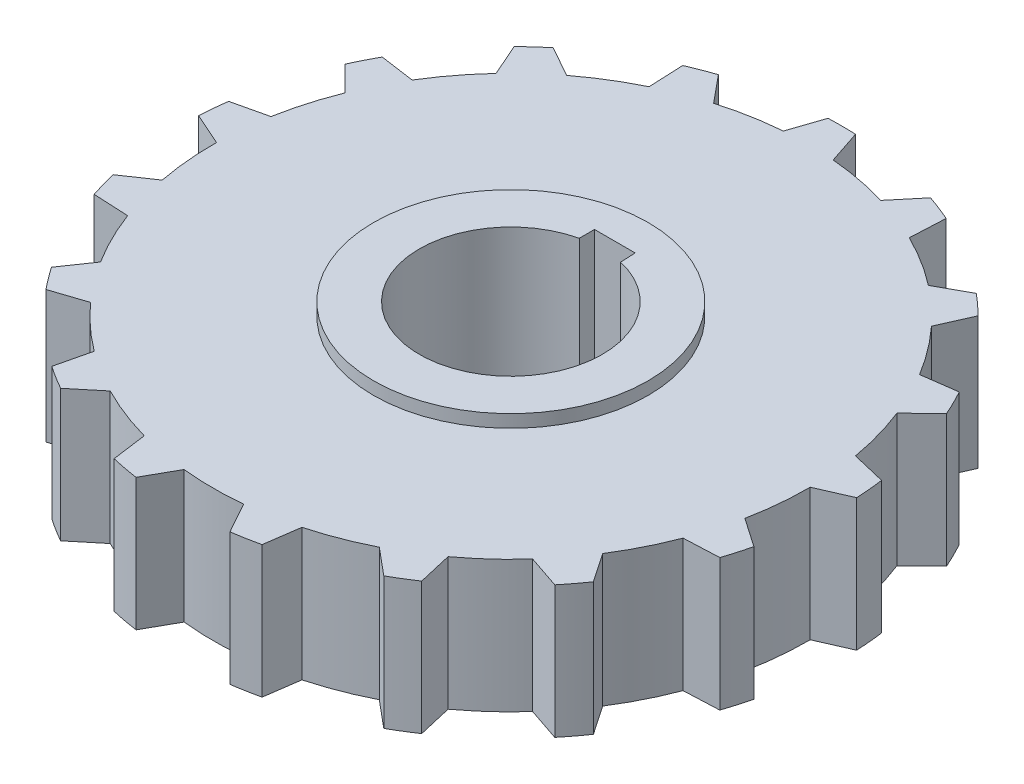
from build123d import *

# Parameters (mm, degrees)
SKETCH3_R           = 165
BOSS_EXTRUDE1_DEPTH = 32.5
SKETCH5_R           = 67.5
BOSS_EXTRUDE2_DEPTH = 38.75
CUT_EXTRUDE1_DEPTH  = 77.5
CUT_EXTRUDE2_START  = -65
CUT_EXTRUDE2_DEPTH  = 65
CUT_EXTRUDE4_DEPTH  = 244.931170023
SKETCH10_R          = 165
SKETCH10_R_2        = 162.5
CUT_EXTRUDE5_DEPTH  = 244.819721335


# Read off the part's stored shape, not the designer's step: Cut-Extrude2
with BuildPart() as part:
    # Sketch3 → Boss-Extrude1 (new, symmetric)
    with BuildSketch(Plane(origin=(0, 0, 0), x_dir=(1, 0, 0), z_dir=(0, 1, 0))):
        with Locations(Location((0, 0, 0), (0, 0, 270))):
            Circle(SKETCH3_R)
    extrude(amount=BOSS_EXTRUDE1_DEPTH, both=True)

    # Sketch5 → Boss-Extrude2 (add, symmetric)
    with BuildSketch(Plane(origin=(0, 0, 0), x_dir=(1, 0, 0), z_dir=(0, 1, 0))):
        with Locations(Location((0, 0, 0), (0, 0, 270))):
            Circle(SKETCH5_R)
    extrude(amount=BOSS_EXTRUDE2_DEPTH, both=True)

    # Sketch6 → Cut-Extrude1 (cut)
    with BuildSketch(Plane(origin=(0, 38.75, 0), x_dir=(1, 0, 0), z_dir=(0, 1, 0))):
        with BuildLine():
            Line((-10.176530617, 43.834212946), (-10.176530617, 51.334212946))
            Line((-10.176530617, 51.334212946), (9.823467655, 51.325898107))
            Line((9.823467655, 51.325898107), (10.176530617, 43.834212946))
            ThreePointArc((10.176530617, 43.834212946), (0, -45), (-10.176530617, 43.834212946))
        make_face()
    extrude(amount=-CUT_EXTRUDE1_DEPTH, mode=Mode.SUBTRACT)

    # Cut-Extrude2 outline → Cut-Extrude2 (cut)
    with BuildSketch(Plane(origin=(0, 32.5, 0), x_dir=(1, 0, 0), z_dir=(0, 1, 0)).offset(CUT_EXTRUDE2_START)):
        with BuildLine():
            ThreePointArc((-144.901893855, -21.164686614), (-145.807749666, -13.586866441), (-146.317587116, -5.972143919))
            Line((-146.317587116, -5.972143919), (-164.906164085, 5.563905713))
            ThreePointArc((-164.906164085, 5.563905713), (-164.325820919, -14.900489227), (-161.215685462, -35.135491472))
            Line((-161.215685462, -35.135491472), (-144.901893855, -21.164686614))
        make_face()
        with BuildLine():
            ThreePointArc((-151.760503896, 64.759165043), (-158.611942136, 45.467040938), (-163.021553119, 25.474952768))
            Line((-163.021553119, 25.474952768), (-142.762558665, 32.609119058))
            ThreePointArc((-142.762558665, 32.609119058), (-140.869819667, 40.002458791), (-138.594473879, 47.287150608))
            Line((-138.594473879, 47.287150608), (-151.760503896, 64.759165043))
        make_face()
        with BuildLine():
            Line((-134.279699439, -58.424867317), (-155.780333037, -54.382789914))
            ThreePointArc((-155.780333037, -54.382789914), (-147.846587026, -73.255625755), (-137.636746156, -91.000692896))
            Line((-137.636746156, -91.000692896), (-127.471425351, -72.080084082))
            ThreePointArc((-127.471425351, -72.080084082), (-131.053535124, -65.341210074), (-134.279699439, -58.424867317))
        make_face()
        with BuildLine():
            ThreePointArc((-118.118746723, 115.208340291), (-131.476641669, 99.693995283), (-142.810456694, 82.644863475))
            Line((-142.810456694, 82.644863475), (-121.342348853, 81.978882508))
            ThreePointArc((-121.342348853, 81.978882508), (-116.906639936, 88.189230302), (-112.153408966, 94.160053418))
            Line((-112.153408966, 94.160053418), (-118.118746723, 115.208340291))
        make_face()
        with BuildLine():
            Line((-104.106594283, -102.98698864), (-125.615504804, -106.984788418))
            ThreePointArc((-125.615504804, -106.984788418), (-111.399852309, -121.717184101), (-95.46920161, -134.575746492))
            Line((-95.46920161, -134.575746492), (-92.82523451, -113.260666785))
            ThreePointArc((-92.82523451, -113.260666785), (-98.59981447, -108.270861218), (-104.106594283, -102.98698864))
        make_face()
        with BuildLine():
            ThreePointArc((-68.524398286, 150.097990791), (-86.584692207, 140.45672314), (-103.312016753, 128.653127418))
            Line((-103.312016753, 128.653127418), (-83.534182446, 120.276943615))
            ThreePointArc((-83.534182446, 120.276943615), (-77.154570678, 124.465557588), (-70.565404709, 128.316119255))
            Line((-70.565404709, 128.316119255), (-68.524398286, 150.097990791))
        make_face()
        with BuildLine():
            Line((-59.873316695, -133.640146477), (-78.485606588, -145.137898423))
            ThreePointArc((-78.485606588, -145.137898423), (-59.90795025, -153.740162277), (-40.408012374, -159.975599814))
            Line((-40.408012374, -159.975599814), (-45.642481386, -139.144768839))
            ThreePointArc((-45.642481386, -139.144768839), (-52.829642513, -136.577932604), (-59.873316695, -133.640146477))
        make_face()
        with BuildLine():
            ThreePointArc((-9.675450153, 164.716075913), (-29.99900028, 162.249992241), (-49.860716477, 157.286073612))
            Line((-49.860716477, 157.286073612), (-34.444261822, 142.330937009))
            ThreePointArc((-34.444261822, 142.330937009), (-26.982349124, 143.932121634), (-19.44715153, 145.142382162))
            Line((-19.44715153, 145.142382162), (-9.675450153, 164.716075913))
        make_face()
        with BuildLine():
            Line((-7.553815918, -146.244462006), (-20.755792298, -163.689331009))
            ThreePointArc((-20.755792298, -163.689331009), (-0.325147548, -164.999679633), (20.110502842, -163.769861927))
            Line((20.110502842, -163.769861927), (7.704541763, -146.236598834))
            ThreePointArc((7.704541763, -146.236598834), (0.075465406, -146.439397388), (-7.553815918, -146.244462006))
        make_face()
        with BuildLine():
            ThreePointArc((50.480221136, 157.08834226), (30.638222865, 162.130500831), (10.324549847, 164.676664013))
            Line((10.324549847, 164.676664013), (19.297547224, 145.162348677))
            ThreePointArc((19.297547224, 145.162348677), (26.833988195, 143.959855098), (34.297547224, 142.366362097))
            Line((34.297547224, 142.366362097), (50.480221136, 157.08834226))
        make_face()
        with BuildLine():
            Line((45.785869556, -139.097652573), (39.777206754, -160.133612408))
            ThreePointArc((39.777206754, -160.133612408), (59.301568133, -153.97507596), (77.912983213, -145.446096705))
            Line((77.912983213, -145.446096705), (60.011023855, -133.578365832))
            ThreePointArc((60.011023855, -133.578365832), (52.970381303, -136.523410106), (45.785869556, -139.097652573))
        make_face()
        with BuildLine():
            ThreePointArc((103.81825884, 128.244957528), (87.13758424, 140.114386888), (69.115428503, 149.826758434))
            Line((69.115428503, 149.826758434), (70.433115586, 128.388780784))
            ThreePointArc((70.433115586, 128.388780784), (77.026246716, 124.545012422), (83.410172176, 120.362975952))
            Line((83.410172176, 120.362975952), (103.81825884, 128.244957528))
        make_face()
        with BuildLine():
            Line((92.941919639, -113.164934393), (94.93807362, -134.950962121))
            ThreePointArc((94.93807362, -134.950962121), (110.919278435, -122.155285074), (125.192883471, -107.479030179))
            Line((125.192883471, -107.479030179), (104.212684643, -102.87963434))
            ThreePointArc((104.212684643, -102.87963434), (98.711353687, -108.169179786), (92.941919639, -113.164934393))
        make_face()
        with BuildLine():
            ThreePointArc((143.135065411, 82.081380652), (131.868532017, 99.175048594), (118.571885559, 114.741918909))
            Line((118.571885559, 114.741918909), (112.056301405, 94.275596619))
            ThreePointArc((112.056301405, 94.275596619), (116.815683801, 88.309675691), (121.257791184, 82.103902949))
            Line((121.257791184, 82.103902949), (143.135065411, 82.081380652))
        make_face()
        with BuildLine():
            Line((127.545648465, -71.948664755), (137.277027574, -91.54243661))
            ThreePointArc((137.277027574, -91.54243661), (147.55672556, -73.837746052), (155.564791098, -54.996325066))
            Line((155.564791098, -54.996325066), (134.339844907, -58.286438155))
            ThreePointArc((134.339844907, -58.286438155), (131.120810776, -65.206102351), (127.545648465, -71.948664755))
        make_face()
        with BuildLine():
            ThreePointArc((163.12068826, 24.83225849), (158.789903837, 44.84157044), (152.01455244, 64.160547429))
            Line((152.01455244, 64.160547429), (138.545662793, 47.429970732))
            ThreePointArc((138.545662793, 47.429970732), (140.82851549, 40.147627916), (142.72887358, 32.756242901))
            Line((142.72887358, 32.756242901), (163.12068826, 24.83225849))
        make_face()
        with BuildLine():
            Line((144.923630711, -21.015329261), (161.075958276, -35.770597781))
            ThreePointArc((161.075958276, -35.770597781), (164.265819258, -15.548010277), (164.926811673, 4.913938493))
            Line((164.926811673, 4.913938493), (146.323664713, -5.821335521))
            ThreePointArc((146.323664713, -5.821335521), (145.821675804, -13.436579474), (144.923630711, -21.015329261))
        make_face()
    extrude(amount=CUT_EXTRUDE2_DEPTH, mode=Mode.SUBTRACT)

    # Sketch9 → Cut-Extrude4 (cut, through all)
    with BuildSketch(Plane(origin=(0, 32.5, 0), x_dir=(1, 0, 0), z_dir=(0, 1, 0))):
        with BuildLine():
            Line((-5.487093592, 164.908737803), (-11.895777239, 145.955449663))
            ThreePointArc((-11.895777239, 145.955449663), (-15.676736447, 145.597880262), (-19.44715153, 145.142382162))
            Line((-19.44715153, 145.142382162), (-20.251209919, 147.961121018))
            Line((-20.251209919, 147.961121018), (-10.203781376, 165.845543824))
            Line((-10.203781376, 165.845543824), (-5.487093592, 164.908737803))
        make_face()
        with BuildLine():
            Line((6.379749343, 164.876616894), (12.690126804, 145.888531023))
            ThreePointArc((12.690126804, 145.888531023), (15.997957921, 145.56293534), (19.297547224, 145.162348677))
            Line((19.297547224, 145.162348677), (21.04372139, 145.888531023))
            Line((21.04372139, 145.888531023), (10.594395706, 165.845543824))
            Line((10.594395706, 165.845543824), (6.379749343, 164.876616894))
        make_face()
        with BuildLine():
            Line((34.566031027, 145.285217195), (34.297547224, 142.366362097))
            ThreePointArc((34.297547224, 142.366362097), (37.977899474, 141.429070399), (41.632707903, 140.396653931))
            Line((41.632707903, 140.396653931), (54.455344819, 155.754985219))
            Line((54.455344819, 155.754985219), (50.395577812, 158.332394972))
            Line((50.395577812, 158.332394972), (34.566031027, 145.285217195))
        make_face()
        with BuildLine():
            Line((65.509242895, 151.438235249), (64.534206856, 131.452801217))
            ThreePointArc((64.534206856, 131.452801217), (67.501048785, 129.95426586), (70.433115586, 128.388780784))
            Line((70.433115586, 128.388780784), (72.323701824, 128.43513479))
            Line((72.323701824, 128.43513479), (69.789300364, 150.819226829))
            Line((69.789300364, 150.819226829), (65.509242895, 151.438235249))
        make_face()
        with BuildLine():
            Line((84.714937945, 122.987739735), (83.410172176, 120.362975952))
            ThreePointArc((83.410172176, 120.362975952), (86.503409629, 118.159480893), (89.538465148, 115.876512121))
            Line((89.538465148, 115.876512121), (107.043287164, 125.565658813))
            Line((107.043287164, 125.565658813), (104.188734966, 129.435578829))
            Line((104.188734966, 129.435578829), (84.714937945, 122.987739735))
        make_face()
        with BuildLine():
            Line((115.791350195, 117.547280786), (107.662584677, 99.263642201))
            ThreePointArc((107.662584677, 99.263642201), (109.887748975, 96.794552675), (112.056301405, 94.275596619))
            Line((112.056301405, 94.275596619), (113.835965567, 93.635861919))
            Line((113.835965567, 93.635861919), (119.558773292, 115.423937533))
            Line((119.558773292, 115.423937533), (115.791350195, 117.547280786))
        make_face()
        with BuildLine():
            Line((123.422623072, 84.080086526), (121.257791184, 82.103902949))
            ThreePointArc((121.257791184, 82.103902949), (123.346154982, 78.931798748), (125.351556524, 75.706605255))
            Line((125.351556524, 75.706605255), (145.17444043, 78.417994401))
            Line((145.17444043, 78.417994401), (143.910626133, 83.057770538))
            Line((143.910626133, 83.057770538), (123.422623072, 84.080086526))
        make_face()
        with BuildLine():
            Line((150.435194029, 67.7809147), (136.250533858, 53.668378268))
            ThreePointArc((136.250533858, 53.668378268), (137.433499757, 50.562198793), (138.545662793, 47.429970732))
            Line((138.545662793, 47.429970732), (139.974051374, 46.190547043))
            Line((139.974051374, 46.190547043), (153.181171389, 64.440005886))
            Line((153.181171389, 64.440005886), (150.435194029, 67.7809147))
        make_face()
        with BuildLine():
            Line((145.461399045, 33.816951728), (142.72887358, 32.756242901))
            ThreePointArc((142.72887358, 32.756242901), (143.530318619, 29.043939806), (144.235225595, 25.312101845))
            Line((144.235225595, 25.312101845), (163.698981077, 20.679545316))
            Line((163.698981077, 20.679545316), (164.196589804, 25.462550097))
            Line((164.196589804, 25.462550097), (145.461399045, 33.816951728))
        make_face()
        with BuildLine():
            Line((164.761931319, 8.860360497), (146.437093451, 0.824902462))
            ThreePointArc((146.437093451, 0.824902462), (146.418094852, -2.49886021), (146.323664713, -5.821335521))
            Line((146.323664713, -5.821335521), (147.207865919, -7.493057163))
            Line((147.207865919, -7.493057163), (166.115603483, 4.753094371))
            Line((166.115603483, 4.753094371), (164.761931319, 8.860360497))
        make_face()
        with BuildLine():
            Line((147.854807047, -21.013349787), (144.923630711, -21.015329261))
            ThreePointArc((144.923630711, -21.015329261), (144.329917398, -24.766464144), (143.639128215, -28.500941179))
            Line((143.639128215, -28.500941179), (160.115067242, -39.851790953))
            Line((160.115067242, -39.851790953), (162.306894177, -35.571528828))
            Line((162.306894177, -35.571528828), (147.854807047, -21.013349787))
        make_face()
        with BuildLine():
            Line((156.836656807, -51.256834487), (136.846512137, -52.129980992))
            ThreePointArc((136.846512137, -52.129980992), (135.628114906, -55.222434295), (134.339844907, -58.286438155))
            Line((134.339844907, -58.286438155), (134.560442465, -60.164682478))
            Line((134.560442465, -60.164682478), (156.615202849, -55.575748877))
            Line((156.615202849, -55.575748877), (156.836656807, -51.256834487))
        make_face()
        with BuildLine():
            Line((130.279604066, -73.005681975), (127.545648465, -71.948664755))
            ThreePointArc((127.545648465, -71.948664755), (125.636961073, -75.232019877), (123.643770637, -78.464774167))
            Line((123.643770637, -78.464774167), (134.906726347, -95.000922028))
            Line((134.906726347, -95.000922028), (138.496753118, -91.801475676))
            Line((138.496753118, -91.801475676), (130.279604066, -73.005681975))
        make_face()
        with BuildLine():
            Line((127.729722731, -104.451509951), (108.774051067, -98.044421651))
            ThreePointArc((108.774051067, -98.044421651), (106.5208065, -100.487912631), (104.212684643, -102.87963434))
            Line((104.212684643, -102.87963434), (103.739885631, -104.710734041))
            Line((103.739885631, -104.710734041), (125.963051235, -108.398779284))
            Line((125.963051235, -108.398779284), (127.729722731, -104.451509951))
        make_face()
        with BuildLine():
            Line((95.109418652, -115.138192273), (92.941919639, -113.164934393))
            ThreePointArc((92.941919639, -113.164934393), (89.976036976, -115.53707445), (86.949636701, -117.831504616))
            Line((86.949636701, -117.831504616), (91.478484516, -137.319652165))
            Line((91.478484516, -137.319652165), (95.981858114, -135.633124544))
            Line((95.981858114, -135.633124544), (95.109418652, -115.138192273))
        make_face()
        with BuildLine():
            Line((81.372181826, -143.539430209), (66.011051662, -130.717419883))
            ThreePointArc((66.011051662, -130.717419883), (63.027272925, -132.181941543), (60.011023855, -133.578365832))
            Line((60.011023855, -133.578365832), (58.9086824, -135.115020749))
            Line((58.9086824, -135.115020749), (78.298891566, -146.58195389))
            Line((78.298891566, -146.58195389), (81.372181826, -143.539430209))
        make_face()
        with BuildLine():
            Line((47.094179229, -141.720651702), (45.785869556, -139.097652573))
            ThreePointArc((45.785869556, -139.097652573), (42.163350512, -140.238206905), (38.512472524, -141.284437439))
            Line((38.512472524, -141.284437439), (35.695566451, -161.092602362))
            Line((35.695566451, -161.092602362), (40.504081318, -161.146768373))
            Line((40.504081318, -161.146768373), (47.094179229, -141.720651702))
        make_face()
        with BuildLine():
            Line((24.024876866, -163.241555039), (14.332893951, -145.736306229))
            ThreePointArc((14.332893951, -145.736306229), (11.021556895, -146.024066804), (7.704541763, -146.236598834))
            Line((7.704541763, -146.236598834), (6.121535186, -147.271275207))
            Line((6.121535186, -147.271275207), (20.060032723, -164.968423384))
            Line((20.060032723, -164.968423384), (24.024876866, -163.241555039))
        make_face()
        with BuildLine():
            Line((-7.281390057, -149.162951818), (-7.553815918, -146.244462006))
            ThreePointArc((-7.553815918, -146.244462006), (-11.343730075, -145.999392431), (-15.126014473, -145.656124102))
            Line((-15.126014473, -145.656124102), (-24.908235659, -163.109103965))
            Line((-24.908235659, -163.109103965), (-20.443996102, -164.896648189))
            Line((-20.443996102, -164.896648189), (-7.281390057, -149.162951818))
        make_face()
        with BuildLine():
            Line((-36.56712084, -160.897003308), (-39.28100051, -141.072696867))
            ThreePointArc((-39.28100051, -141.072696867), (-42.472681466, -140.144832696), (-45.642481386, -139.144768839))
            Line((-45.642481386, -139.144768839), (-47.492359274, -139.53772789))
            Line((-47.492359274, -139.53772789), (-40.888044696, -161.074993179))
            Line((-40.888044696, -161.074993179), (-36.56712084, -160.897003308))
        make_face()
        with BuildLine():
            Line((-60.673567267, -136.45996875), (-59.873316695, -133.640146477))
            ThreePointArc((-59.873316695, -133.640146477), (-63.318777057, -132.042550999), (-66.721649399, -130.356144097))
            Line((-66.721649399, -130.356144097), (-82.148042522, -143.096817259))
            Line((-82.148042522, -143.096817259), (-78.630998563, -146.376321943))
            Line((-78.630998563, -146.376321943), (-60.673567267, -136.45996875))
        make_face()
        with BuildLine():
            Line((-92.220526252, -136.822419719), (-87.589778189, -117.356438082))
            ThreePointArc((-87.589778189, -117.356438082), (-90.230748846, -115.338262363), (-92.82523451, -113.260666785))
            Line((-92.82523451, -113.260666785), (-94.692147451, -112.958837216))
            Line((-94.692147451, -112.958837216), (-96.313965111, -135.427492597))
            Line((-96.313965111, -135.427492597), (-92.220526252, -136.822419719))
        make_face()
        with BuildLine():
            Line((-105.871443015, -105.327310752), (-104.106594283, -102.98698864))
            ThreePointArc((-104.106594283, -102.98698864), (-106.742272336, -100.252631382), (-109.306155856, -97.450844503))
            Line((-109.306155856, -97.450844503), (-128.293301045, -103.758512456))
            Line((-128.293301045, -103.758512456), (-126.19844896, -108.087062319))
            Line((-126.19844896, -108.087062319), (-105.871443015, -105.327310752))
        make_face()
        with BuildLine():
            Line((-135.419038582, -94.269210188), (-124.069070971, -77.790542039))
            ThreePointArc((-124.069070971, -77.790542039), (-125.802653609, -74.954620587), (-127.471425351, -72.080084082))
            Line((-127.471425351, -72.080084082), (-129.103236407, -71.124229649))
            Line((-129.103236407, -71.124229649), (-138.732150843, -91.489758711))
            Line((-138.732150843, -91.489758711), (-135.419038582, -94.269210188))
        make_face()
        with BuildLine():
            Line((-136.770793729, -59.969615797), (-134.279699439, -58.424867317))
            ThreePointArc((-134.279699439, -58.424867317), (-135.749632257, -54.923038377), (-137.128260278, -51.384268366))
            Line((-137.128260278, -51.384268366), (-157.111838364, -50.407045599))
            Line((-157.111838364, -50.407045599), (-156.722099534, -55.200045998))
            Line((-156.722099534, -55.200045998), (-136.770793729, -59.969615797))
        make_face()
        with BuildLine():
            Line((-160.328459369, -38.984421457), (-143.792148228, -27.718602242))
            ThreePointArc((-143.792148228, -27.718602242), (-144.384212905, -24.447941962), (-144.901893855, -21.164686614))
            Line((-144.901893855, -21.164686614), (-146.078217901, -19.683900756))
            Line((-146.078217901, -19.683900756), (-162.413790863, -35.195825949))
            Line((-162.413790863, -35.195825949), (-160.328459369, -38.984421457))
        make_face()
        with BuildLine():
            Line((-149.198490877, -6.512691927), (-146.317587116, -5.972143919))
            ThreePointArc((-146.317587116, -5.972143919), (-146.423252127, -2.1757847), (-146.430433296, 1.622037945))
            Line((-146.430433296, 1.622037945), (-164.711551324, 9.752172081))
            Line((-164.711551324, 9.752172081), (-166.07956214, 5.142042409))
            Line((-166.07956214, 5.142042409), (-149.198490877, -6.512691927))
        make_face()
        with BuildLine():
            Line((-163.584633307, 21.565429412), (-144.095299088, 26.096888382))
            ThreePointArc((-144.095299088, 26.096888382), (-143.465884188, 29.360566695), (-142.762558665, 32.609119058))
            Line((-142.762558665, 32.609119058), (-143.324526619, 34.414848007))
            Line((-143.324526619, 34.414848007), (-164.16054846, 25.851498135))
            Line((-164.16054846, 25.851498135), (-163.584633307, 21.565429412))
        make_face()
        with BuildLine():
            Line((-141.476105095, 47.823807077), (-138.594473879, 47.287150608))
            ThreePointArc((-138.594473879, 47.287150608), (-137.321600437, 50.865320757), (-135.956364898, 54.409279043))
            Line((-135.956364898, 54.409279043), (-150.066056581, 68.594304882))
            Line((-150.066056581, 68.594304882), (-153.007059599, 64.789669496))
            Line((-153.007059599, 64.789669496), (-141.476105095, 47.823807077))
        make_face()
        with BuildLine():
            Line((-144.747796064, 79.20274954), (-124.937581346, 76.387849622))
            ThreePointArc((-124.937581346, 76.387849622), (-123.171692839, 79.203768127), (-121.342348853, 81.978882508))
            Line((-121.342348853, 81.978882508), (-121.21406383, 83.865680847))
            Line((-121.21406383, 83.865680847), (-143.736514343, 83.407434147))
            Line((-143.736514343, 83.407434147), (-144.747796064, 79.20274954))
        make_face()
        with BuildLine():
            Line((-114.646587374, 95.701435934), (-112.153408966, 94.160053418))
            ThreePointArc((-112.153408966, 94.160053418), (-109.673905684, 97.036782791), (-107.120636061, 99.848245514))
            Line((-107.120636061, 99.848245514), (-115.153309351, 118.172396715))
            Line((-115.153309351, 118.172396715), (-119.270105819, 115.687092705))
            Line((-119.270105819, 115.687092705), (-114.646587374, 95.701435934))
        make_face()
        with BuildLine():
            Line((-106.361966886, 126.143299466), (-88.90635094, 116.362208491))
            ThreePointArc((-88.90635094, 116.362208491), (-86.242481854, 118.350061791), (-83.534182446, 120.276943615))
            Line((-83.534182446, 120.276943615), (-82.732970049, 121.989988773))
            Line((-82.732970049, 121.989988773), (-103.900067493, 129.698734002))
            Line((-103.900067493, 129.698734002), (-106.361966886, 126.143299466))
        make_face()
        with BuildLine():
            Line((-72.333412749, 130.654055568), (-70.565404709, 128.316119255))
            ThreePointArc((-70.565404709, 128.316119255), (-67.214142244, 130.10288961), (-63.817671747, 131.802153151))
            Line((-63.817671747, 131.802153151), (-64.688469607, 151.790651556))
            Line((-64.688469607, 151.790651556), (-69.425063349, 150.960333))
            Line((-69.425063349, 150.960333), (-72.333412749, 130.654055568))
        make_face()
        with BuildLine():
            Line((-53.611364709, 156.047497814), (-40.867825192, 140.621206318))
            ThreePointArc((-40.867825192, 140.621206318), (-37.665745809, 141.51252381), (-34.444261822, 142.330937009))
            Line((-34.444261822, 142.330937009), (-33.078330224, 143.638872746))
            Line((-33.078330224, 143.638872746), (-50.031340797, 158.473501143))
            Line((-50.031340797, 158.473501143), (-53.611364709, 156.047497814))
        make_face()
    extrude(amount=-CUT_EXTRUDE4_DEPTH, mode=Mode.SUBTRACT)

    # Sketch10 → Cut-Extrude5 (cut, through all)
    with BuildSketch(Plane(origin=(0, 32.5, 0), x_dir=(1, 0, 0), z_dir=(0, 1, 0))):
        Circle(SKETCH10_R)
        Circle(SKETCH10_R_2, mode=Mode.SUBTRACT)
    extrude(amount=-CUT_EXTRUDE5_DEPTH, mode=Mode.SUBTRACT)


solid = part.part
